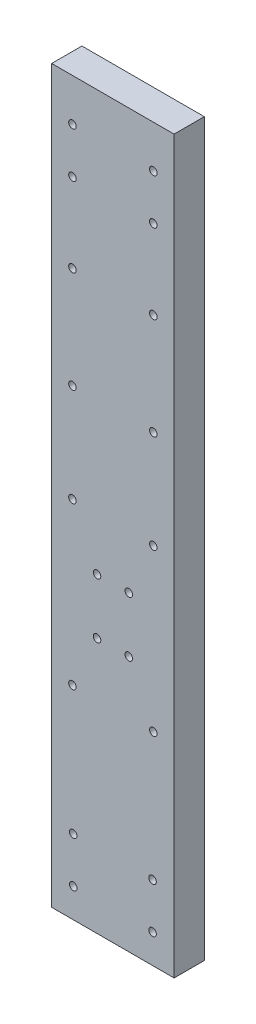
from build123d import *

# Parameters (mm, degrees)
SKETCH3_W           = 16.2
SKETCH3_H           = 96.73
SKETCH3_R           = 0.5
BOSS_EXTRUDE3_DEPTH = 4


with BuildPart() as part:
    # Sketch3 → Boss-Extrude3 (new body)
    with BuildSketch(Plane.XY):
        with Locations((8.1, 48.365)):
            Rectangle(SKETCH3_W, SKETCH3_H)
        with Locations((6, 33.85)):
            Circle(SKETCH3_R, mode=Mode.SUBTRACT)
        with Locations((10.2, 33.85)):
            Circle(SKETCH3_R, mode=Mode.SUBTRACT)
        with Locations((2.75, 85.12)):
            Circle(SKETCH3_R, mode=Mode.SUBTRACT)
        with Locations((10.2, 41.17)):
            Circle(SKETCH3_R, mode=Mode.SUBTRACT)
        with Locations((13.45, 48.17)):
            Circle(SKETCH3_R, mode=Mode.SUBTRACT)
        with Locations((2.75, 91.12)):
            Circle(SKETCH3_R, mode=Mode.SUBTRACT)
        with Locations((13.45, 85.12)):
            Circle(SKETCH3_R, mode=Mode.SUBTRACT)
        with Locations((2.75, 61.17)):
            Circle(SKETCH3_R, mode=Mode.SUBTRACT)
        with Locations((2.85, 9.846448831)):
            Circle(SKETCH3_R, mode=Mode.SUBTRACT)
        with Locations((13.35, 9.846448831)):
            Circle(SKETCH3_R, mode=Mode.SUBTRACT)
        with Locations((13.35, 3.846448831)):
            Circle(SKETCH3_R, mode=Mode.SUBTRACT)
        with Locations((2.85, 3.846448831)):
            Circle(SKETCH3_R, mode=Mode.SUBTRACT)
        with Locations((13.45, 61.17)):
            Circle(SKETCH3_R, mode=Mode.SUBTRACT)
        with Locations((2.75, 74.62)):
            Circle(SKETCH3_R, mode=Mode.SUBTRACT)
        with Locations((13.45, 26.85)):
            Circle(SKETCH3_R, mode=Mode.SUBTRACT)
        with Locations((13.45, 74.62)):
            Circle(SKETCH3_R, mode=Mode.SUBTRACT)
        with Locations((13.45, 91.12)):
            Circle(SKETCH3_R, mode=Mode.SUBTRACT)
        with Locations((2.75, 26.85)):
            Circle(SKETCH3_R, mode=Mode.SUBTRACT)
        with Locations((6, 41.17)):
            Circle(SKETCH3_R, mode=Mode.SUBTRACT)
        with Locations((2.75, 48.17)):
            Circle(SKETCH3_R, mode=Mode.SUBTRACT)
    extrude(amount=BOSS_EXTRUDE3_DEPTH)


solid = part.part
